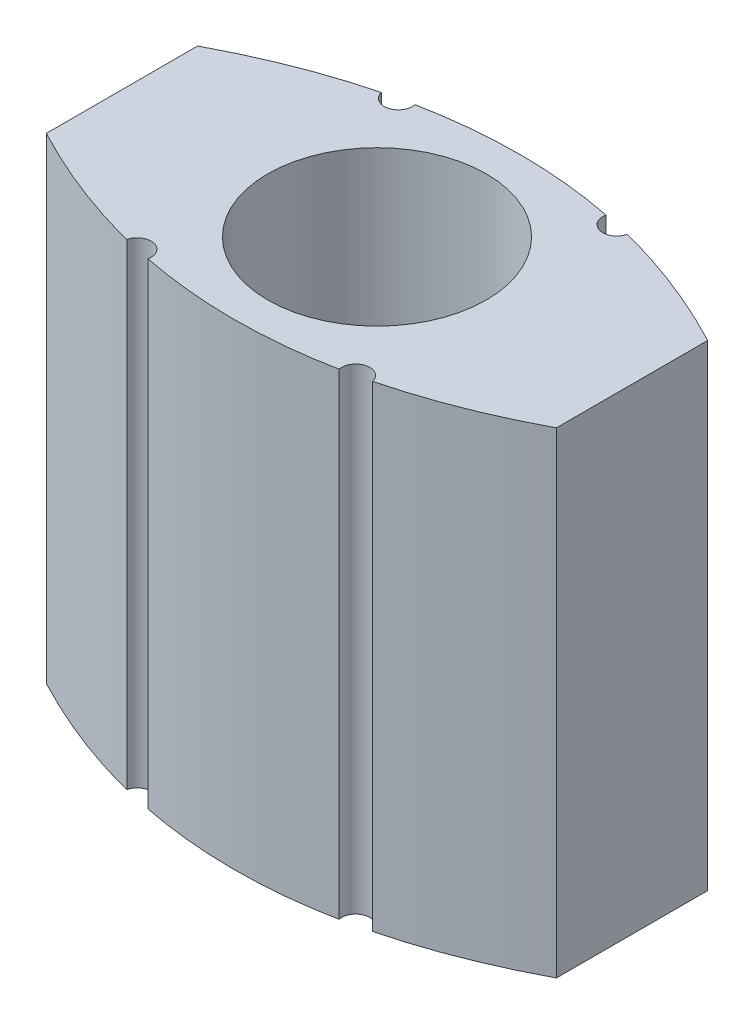
from build123d import *

# Parameters (mm, degrees)
BOSS_EXTRUDE1_DEPTH = 17
SKETCH2_R           = 3.9
CUT_EXTRUDE1_DEPTH  = 7.9
CUT_EXTRUDE2_START  = -7.9
SKETCH3_R           = 3.9
CUT_EXTRUDE2_DEPTH  = 7.9
SKETCH4_R           = 2.7
CUT_EXTRUDE3_DEPTH  = 1.2
SHELL1_DEPTH        = 15.8
SKETCH8_R           = 0.5
CUT_EXTRUDE4_DEPTH  = 17


# Read off the part's stored shape, not the designer's step: Shell1
with BuildPart() as part:
    # Sketch1 → Boss-Extrude1 (new body)
    with BuildSketch(Plane(origin=(0, 0, 0), x_dir=(1, 0, 0), z_dir=(0, 1, 0))):
        with BuildLine():
            Line((-9.1, 2.7), (-9.1, -2.7))
            add(Edge.make_bspline(
                [(-9.1, -2.7), (0, -7.5), (9.1, -2.7)],
                knots=[0, 0, 0, 1, 1, 1], degree=2))
            Line((9.1, -2.7), (9.1, 2.7))
            add(Edge.make_bspline(
                [(-9.1, 2.7), (0, 7.5), (9.1, 2.7)],
                knots=[0, 0, 0, 1, 1, 1], degree=2))
        make_face()
    extrude(amount=BOSS_EXTRUDE1_DEPTH)

    # Sketch2 → Cut-Extrude1 (cut)
    with BuildSketch(Plane(origin=(0, 17, 0), x_dir=(1, 0, 0), z_dir=(0, 1, 0))):
        with Locations(Location((0, 0, 0), (0, 0, 270))):
            Circle(SKETCH2_R)
    extrude(amount=-CUT_EXTRUDE1_DEPTH, mode=Mode.SUBTRACT)

    # Sketch3 → Cut-Extrude2 (cut)
    with BuildSketch(Plane(origin=(0, 0, 0), x_dir=(-1, 0, 0), z_dir=(0, -1, 0)).offset(CUT_EXTRUDE2_START)):
        with Locations(Location((0, 0, 0), (0, 0, 270))):
            Circle(SKETCH3_R)
    extrude(amount=CUT_EXTRUDE2_DEPTH, mode=Mode.SUBTRACT)

    # Sketch4 → Cut-Extrude3 (cut)
    with BuildSketch(Plane.XZ.offset(-7.9)):
        with Locations(Location((0, 0, 0), (0, 0, 270))):
            Circle(SKETCH4_R)
    extrude(amount=-CUT_EXTRUDE3_DEPTH, mode=Mode.SUBTRACT)

    # Shell1 outline → Shell1 (cut)
    with BuildSketch(Plane(origin=(0, 0, 0), x_dir=(1, 0, 0), z_dir=(0, 1, 0))):
        with BuildLine():
            Line((-7.899999781, 1.963775482), (-7.899999781, -1.963775482))
            add(Edge.make_bspline(
                [(-7.899999781, -1.963775482), (-7.481101996, -2.168383254), (-7.062952664, -2.360723495), (-6.645550136, -2.540844903), (-6.228886411, -2.708799004), (-5.812947019, -2.864639229), (-5.397710236, -3.008420202), (-4.983146308, -3.140196716), (-4.569217021, -3.260022384), (-4.155875768, -3.367948145), (-3.7430681, -3.46402079)],
                knots=[0.036996465, 0.036996465, 0.036996465, 0.036996465, 0.036996465, 0.036996465, 0.036996465, 0.036996465, 0.036996465, 0.036996465, 0.036996465, 0.279391491, 0.279391491, 0.279391491, 0.279391491, 0.279391491, 0.279391491, 0.279391491, 0.279391491, 0.279391491, 0.279391491, 0.279391491], degree=10))
            ThreePointArc((-3.7430681, -3.46402079), (-5.1, 0), (-3.74306828, 3.464020764))
            add(Edge.make_bspline(
                [(-3.74306828, 3.464020764), (-4.155875768, 3.367948145), (-4.569217021, 3.260022384), (-4.983146308, 3.140196716), (-5.397710236, 3.008420202), (-5.812947019, 2.864639229), (-6.228886411, 2.708799004), (-6.645550136, 2.540844903), (-7.062952664, 2.360723495), (-7.481101996, 2.168383254), (-7.899999781, 1.963775482)],
                knots=[0.720608509, 0.720608509, 0.720608509, 0.720608509, 0.720608509, 0.720608509, 0.720608509, 0.720608509, 0.720608509, 0.720608509, 0.720608509, 0.963003535, 0.963003535, 0.963003535, 0.963003535, 0.963003535, 0.963003535, 0.963003535, 0.963003535, 0.963003535, 0.963003535, 0.963003535], degree=10))
        make_face()
        with BuildLine():
            ThreePointArc((3.74306828, 3.464020764), (5.1, 0), (3.74306828, -3.464020764))
            add(Edge.make_bspline(
                [(3.74306828, -3.464020764), (4.155875768, -3.367948145), (4.569217021, -3.260022384), (4.983146308, -3.140196716), (5.397710236, -3.008420202), (5.812947019, -2.864639229), (6.228886411, -2.708799004), (6.645550136, -2.540844903), (7.062952664, -2.360723495), (7.481101996, -2.168383254), (7.899999781, -1.963775482)],
                knots=[0.720608509, 0.720608509, 0.720608509, 0.720608509, 0.720608509, 0.720608509, 0.720608509, 0.720608509, 0.720608509, 0.720608509, 0.720608509, 0.963003535, 0.963003535, 0.963003535, 0.963003535, 0.963003535, 0.963003535, 0.963003535, 0.963003535, 0.963003535, 0.963003535, 0.963003535], degree=10))
            Line((7.899999781, -1.963775482), (7.899999781, 1.963775482))
            add(Edge.make_bspline(
                [(7.899999781, 1.963775482), (7.481101996, 2.168383254), (7.062952664, 2.360723495), (6.645550136, 2.540844903), (6.228886411, 2.708799004), (5.812947019, 2.864639229), (5.397710236, 3.008420202), (4.983146308, 3.140196716), (4.569217021, 3.260022384), (4.155875768, 3.367948145), (3.74306828, 3.464020764)],
                knots=[0.036996465, 0.036996465, 0.036996465, 0.036996465, 0.036996465, 0.036996465, 0.036996465, 0.036996465, 0.036996465, 0.036996465, 0.036996465, 0.279391491, 0.279391491, 0.279391491, 0.279391491, 0.279391491, 0.279391491, 0.279391491, 0.279391491, 0.279391491, 0.279391491, 0.279391491], degree=10))
        make_face()
    extrude(amount=SHELL1_DEPTH, mode=Mode.SUBTRACT)

    # Sketch8 → Cut-Extrude4 (cut)
    with BuildSketch(Plane.XZ):
        with Locations((-3.9, 4.659183673)):
            Circle(SKETCH8_R)
        with Locations((-3.9, -4.659183673)):
            Circle(SKETCH8_R)
    cut_extrude4 = extrude(amount=-CUT_EXTRUDE4_DEPTH, mode=Mode.SUBTRACT)

    # Mirror1: Cut-Extrude4 across plane
    add(cut_extrude4.mirror(Plane(origin=(0, 0, 0), x_dir=(0, 0, 1), z_dir=(1, 0, 0))), mode=Mode.SUBTRACT)


solid = part.part
